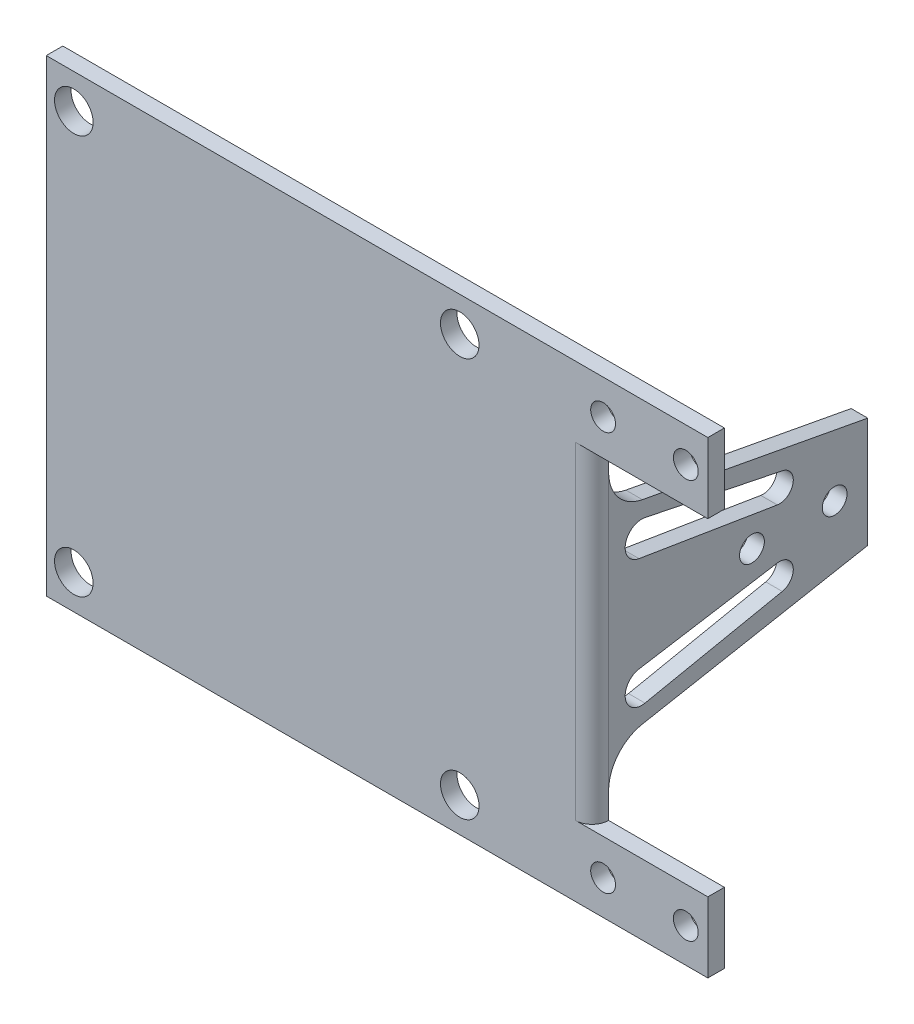
from build123d import *

# Parameters (mm, degrees)
SKETCH1_R           = 3.5
SKETCH1_R_2         = 2.25
BOSS_EXTRUDE1_DEPTH = 3
SKETCH3_R           = 2.25
BOSS_EXTRUDE2_DEPTH = 3
FILLET1_R           = 3
FILLET2_R           = 3


with BuildPart() as part:
    # Sketch1 → Boss-Extrude1 (new body)
    with BuildSketch(Plane.XY):
        Polygon((120, 29.7), (96, 29.7), (96, -29.7), (120, -29.7), (120, -42.45), (0, -42.45), (0, 42.45), (120, 42.45), align=None)
        with Locations((5, 36.2)):
            Circle(SKETCH1_R, mode=Mode.SUBTRACT)
        with Locations((75, 36.2)):
            Circle(SKETCH1_R, mode=Mode.SUBTRACT)
        with Locations((5, -36.2)):
            Circle(SKETCH1_R, mode=Mode.SUBTRACT)
        with Locations((75, -36.2)):
            Circle(SKETCH1_R, mode=Mode.SUBTRACT)
        with Locations((116, 36.2)):
            Circle(SKETCH1_R_2, mode=Mode.SUBTRACT)
        with Locations((101, 36.2)):
            Circle(SKETCH1_R_2, mode=Mode.SUBTRACT)
        with Locations((101, -36.2)):
            Circle(SKETCH1_R_2, mode=Mode.SUBTRACT)
        with Locations((116, -36.2)):
            Circle(SKETCH1_R_2, mode=Mode.SUBTRACT)
    extrude(amount=-BOSS_EXTRUDE1_DEPTH)

    # Sketch3 → Boss-Extrude2 (add)
    with BuildSketch(Plane(origin=(96, 0, 0), x_dir=(0, 0, -1), z_dir=(1, 0, 0))):
        with BuildLine():
            Line((0, 29.7), (0, -29.7))
            Line((0, -29.7), (3, -29.7))
            Line((3, -29.7), (3, -25))
            ThreePointArc((3, -25), (4.730773609, -20.207711731), (9.124273828, -17.627254412))
            Line((9.124273828, -17.627254412), (50, -10))
            Line((50, -10), (50, 10))
            Line((50, 10), (9.124273828, 17.627254412))
            ThreePointArc((9.124273828, 17.627254412), (4.730773609, 20.207711731), (3, 25))
            Line((3, 25), (3, 29.7))
            Line((3, 29.7), (0, 29.7))
        make_face()
        with Locations((29, 0)):
            Circle(SKETCH3_R, mode=Mode.SUBTRACT)
        with Locations((44, 0)):
            Circle(SKETCH3_R, mode=Mode.SUBTRACT)
        with BuildLine():
            Line((9.600816641, 14.566475289), (34.500680534, 9.476605143))
            ThreePointArc((34.500680534, 9.476605143), (36.458725143, 6.574848986), (33.596044735, 4.560106232))
            Line((33.596044735, 4.560106232), (8.515253682, 8.666676596))
            ThreePointArc((8.515253682, 8.666676596), (6.049529828, 12.170140924), (9.600816641, 14.566475289))
        make_face(mode=Mode.SUBTRACT)
        with BuildLine():
            ThreePointArc((33.596044735, -4.560106232), (36.458725143, -6.574848986), (34.500680534, -9.476605143))
            Line((34.500680534, -9.476605143), (9.600816641, -14.566475289))
            ThreePointArc((9.600816641, -14.566475289), (6.049529828, -12.170140924), (8.515253682, -8.666676596))
            Line((8.515253682, -8.666676596), (33.596044735, -4.560106232))
        make_face(mode=Mode.SUBTRACT)
    extrude(amount=BOSS_EXTRUDE2_DEPTH)

    # Fillet1
    fillet1_edges = [part.edges().sort_by_distance(p)[0] for p in [
        (99, 0, 0),
    ]]
    fillet(fillet1_edges, radius=FILLET1_R - 0.0001)  # a hair under: the kernel refuses the full size

    # Fillet2
    fillet2_edges = [part.edges().sort_by_distance(p)[0] for p in [
        (96, 0, -3),
    ]]
    fillet(fillet2_edges, radius=FILLET2_R - 0.0001)  # a hair under: the kernel refuses the full size


solid = part.part
